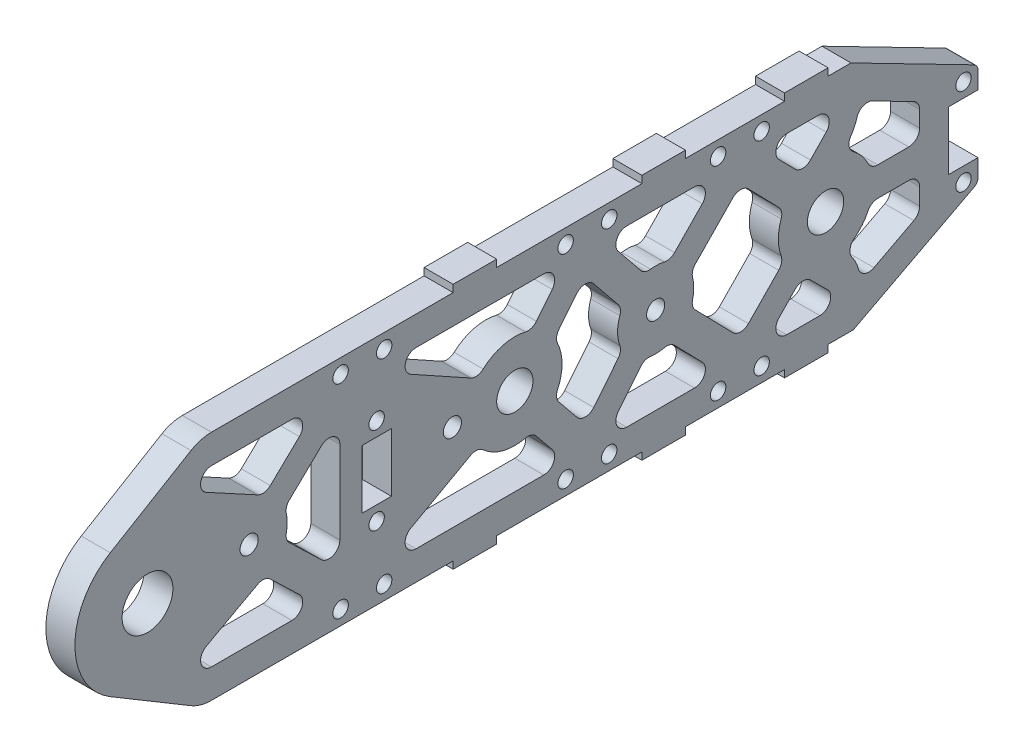
from build123d import *

# Parameters (mm, degrees)
SKETCH1_R                   = 11.1125
SKETCH1_R_2                 = 7.9375
BOSS_EXTRUDE1_DEPTH         = 12.7
BOSS_EXTRUDE2_DEPTH         = 12.7
CUT_EXTRUDE1_DEPTH          = 218.842023092
CUT_EXTRUDE2_DEPTH          = 218.842023092
FILLET1_R                   = 25.4
SKETCH5_W                   = 25.4
SKETCH5_H                   = 101.6
BOSS_EXTRUDE3_DEPTH         = 12.7
SKETCH6_W                   = 144.78
SKETCH6_H                   = 101.6
CUT_EXTRUDE3_DEPTH          = 352.269809441
CUT_EXTRUDE4_DEPTH          = 218.842023092
CUT_EXTRUDE5_DEPTH          = 218.842023092
SKETCH10_W                  = 12.827
SKETCH10_H                  = 25.654
SKETCH10_W_2                = 12.954
CUT_EXTRUDE6_DEPTH          = 218.842023092
F_1_4_CLEARANCE_HOLE1_D     = 6.7564
F_1_4_CLEARANCE_HOLE1_DEPTH = 12.7
F_1_4_CLEARANCE_HOLE1_TIP   = 2.029827343
F_3_8_16_TAPPED_HOLE1_D     = 7.9375
F_3_8_16_TAPPED_HOLE1_DEPTH = 23.876
F_3_8_16_TAPPED_HOLE1_TIP   = 2.384665582
CUT_EXTRUDE7_DEPTH          = 218.842023092
FILLET2_DEPTH               = 12.7
CUT_EXTRUDE8_DEPTH          = 218.842023092
FILLET3_R                   = 3.175
F_1_4_CLEARANCE_HOLE2_D     = 6.7564
SKETCH20_W                  = 19.05
SKETCH20_H                  = 3.175
BOSS_EXTRUDE4_DEPTH         = 12.7
CUT_EXTRUDE9_DEPTH          = 211.017070378
FILLET4_R                   = 4.7625


with BuildPart() as part:
    # Sketch1 → Boss-Extrude1 (new body)
    with BuildSketch(Plane(origin=(0, 0, 0), x_dir=(0, 0, -1), z_dir=(1, 0, 0))):
        with BuildLine():
            Line((93.345, 0), (55.245, 50.8))
            Line((55.245, 50.8), (-160.655, 50.8))
            ThreePointArc((-160.655, 50.8), (-211.455, 0), (-160.655, -50.8))
            Line((-160.655, -50.8), (55.245, -50.8))
            Line((55.245, -50.8), (93.345, 0))
        make_face()
        with Locations((-160.655, 0)):
            Circle(SKETCH1_R, mode=Mode.SUBTRACT)
        Circle(SKETCH1_R_2, mode=Mode.SUBTRACT)
    boss_extrude1 = extrude(amount=BOSS_EXTRUDE1_DEPTH)

    # Sketch2 → Boss-Extrude2 (add)
    with BuildSketch(Plane(origin=(12.7, 0, 0), x_dir=(0, 0, -1), z_dir=(1, 0, 0))):
        Polygon((-160.655, 50.8), (-211.455, 25.4), (-211.455, -25.4), (-160.655, -50.8), (-160.655, -41.746204901), (-204.042256517, 0), (-160.655, 42.284079683), align=None)
    boss_extrude2 = extrude(amount=-BOSS_EXTRUDE2_DEPTH)

    # Sketch3 → Cut-Extrude1 (cut, through all)
    with BuildSketch(Plane(origin=(12.7, 0, 0), x_dir=(0, 0, -1), z_dir=(1, 0, 0))):
        Polygon((-211.455, 25.4), (-160.655, 50.8), (-211.455, 50.8), align=None)
        Polygon((-211.455, -25.4), (-211.455, -50.8), (-160.655, -50.8), align=None)
    cut_extrude1 = extrude(amount=-CUT_EXTRUDE1_DEPTH, mode=Mode.SUBTRACT)

    # Sketch4 → Cut-Extrude2 (cut, through all)
    with BuildSketch(Plane(origin=(12.7, 0, 0), x_dir=(0, 0, -1), z_dir=(1, 0, 0))):
        Polygon((67.945, 33.866666667), (67.945, -33.866666667), (93.345, 0), align=None)
    extrude(amount=-CUT_EXTRUDE2_DEPTH, mode=Mode.SUBTRACT)

    # Fillet1
    fillet1_edges = [part.edges().sort_by_distance(p)[0] for p in [
        (6.35, -50.8, 160.655),
        (6.35, 50.8, 160.655),
        (6.35, 25.4, 211.455),
        (6.35, -25.4, 211.455),
    ]]
    fillet(fillet1_edges, radius=FILLET1_R)

    # Mirror1: Boss-Extrude1, Boss-Extrude2, Cut-Extrude1 across plane
    add(boss_extrude1.mirror(Plane(origin=(0, 33.866666667, -67.945), x_dir=(1, 0, 0), z_dir=(0, 0, 1))))
    add(boss_extrude2.mirror(Plane(origin=(0, 33.866666667, -67.945), x_dir=(1, 0, 0), z_dir=(0, 0, 1))))
    add(cut_extrude1.mirror(Plane(origin=(0, 33.866666667, -67.945), x_dir=(1, 0, 0), z_dir=(0, 0, 1))), mode=Mode.SUBTRACT)

    # Sketch5 → Boss-Extrude3 (add)
    with BuildSketch(Plane(origin=(12.7, 0, 0), x_dir=(0, 0, -1), z_dir=(1, 0, 0))):
        with Locations((67.945, 0)):
            Rectangle(SKETCH5_W, SKETCH5_H)
    extrude(amount=-BOSS_EXTRUDE3_DEPTH)

    # Sketch6 → Cut-Extrude3 (cut, through all)
    with BuildSketch(Plane(origin=(12.7, 0, 0), x_dir=(0, 0, -1), z_dir=(1, 0, 0))):
        with Locations((274.955, 0)):
            Rectangle(SKETCH6_W, SKETCH6_H)
    extrude(amount=-CUT_EXTRUDE3_DEPTH, mode=Mode.SUBTRACT)

    # Sketch7 → Cut-Extrude4 (cut, through all)
    with BuildSketch(Plane.ZY):
        Polygon((-202.565, 25.4), (-151.765, 50.8), (-202.565, 50.8), align=None)
        Polygon((-151.765, -50.8), (-202.565, -25.4), (-202.565, -50.8), align=None)
    extrude(amount=-CUT_EXTRUDE4_DEPTH, mode=Mode.SUBTRACT)

    # Sketch8 → Cut-Extrude5 (cut, through all)
    with BuildSketch(Plane.ZY):
        Polygon((-202.565, 25.4), (-151.765, 50.8), (-147.019656436, 50.8), (-202.565, 22.282951039), align=None)
        Polygon((-202.565, -22.282951039), (-148.057281256, -50.8), (-151.765, -50.8), (-202.565, -25.4), align=None)
    extrude(amount=-CUT_EXTRUDE5_DEPTH, mode=Mode.SUBTRACT)

    # Sketch10 → Cut-Extrude6 (cut, through all)
    with BuildSketch(Plane(origin=(12.7, 0, 0), x_dir=(0, 0, -1), z_dir=(1, 0, 0))):
        with Locations((196.1515, 0)):
            Rectangle(SKETCH10_W, SKETCH10_H)
        with Locations((-60.452, 0)):
            Rectangle(SKETCH10_W_2, SKETCH10_H)
    extrude(amount=-CUT_EXTRUDE6_DEPTH, mode=Mode.SUBTRACT)

    # 1/4 Clearance Hole1
    with Locations(Plane(origin=(12.7, 0, 0), x_dir=(0, 0, -1), z_dir=(1, 0, 0))):
        with Locations((-60.452, 19.05), (-60.452, -19.05), (196.215, -19.05), (196.215, 19.05)):
            Hole(F_1_4_CLEARANCE_HOLE1_D / 2, depth=F_1_4_CLEARANCE_HOLE1_DEPTH)
            with Locations((0, 0, -(F_1_4_CLEARANCE_HOLE1_DEPTH + F_1_4_CLEARANCE_HOLE1_TIP / 2))):  # 118° drill point
                Cone(0, F_1_4_CLEARANCE_HOLE1_D / 2, F_1_4_CLEARANCE_HOLE1_TIP, mode=Mode.SUBTRACT)

    # 3/8-16 Tapped Hole1
    with Locations(Plane(origin=(12.7, 0, 0), x_dir=(0, 0, -1), z_dir=(1, 0, 0))):
        with Locations((-116.205, 0), (-27.305, 0), (61.595, 0)):
            Hole(F_3_8_16_TAPPED_HOLE1_D / 2, depth=F_3_8_16_TAPPED_HOLE1_DEPTH)
            with Locations((0, 0, -(F_3_8_16_TAPPED_HOLE1_DEPTH + F_3_8_16_TAPPED_HOLE1_TIP / 2))):  # 118° drill point
                Cone(0, F_3_8_16_TAPPED_HOLE1_D / 2, F_3_8_16_TAPPED_HOLE1_TIP, mode=Mode.SUBTRACT)

    # Sketch16 → Cut-Extrude7 (cut, through all)
    with BuildSketch(Plane(origin=(12.7, 0, 0), x_dir=(0, 0, -1), z_dir=(1, 0, 0))):
        with BuildLine():
            ThreePointArc((-154.658873372, 38.1), (-151.532109655, 37.709075865), (-148.597838443, 36.560369868))
            Line((-148.597838443, 36.560369868), (-109.443989538, 15.296482684))
            Line((-109.443989538, 15.296482684), (-85.69792684, 38.1))
            Line((-85.69792684, 38.1), (-154.658873372, 38.1))
        make_face()
        with BuildLine():
            Line((-85.69792684, -38.1), (-109.443989538, -15.296482684))
            Line((-109.443989538, -15.296482684), (-148.597838443, -36.560369868))
            ThreePointArc((-148.597838443, -36.560369868), (-151.532109655, -37.709075865), (-154.658873372, -38.1))
            Line((-154.658873372, -38.1), (-85.69792684, -38.1))
        make_face()
        with BuildLine():
            Line((-76.5302, 29.296165006), (-100.690493255, 6.094859064))
            ThreePointArc((-100.690493255, 6.094859064), (-99.82735272, 3.101595738), (-99.53625, 0))
            Line((-99.53625, 0), (-76.5302, 0))
            Line((-76.5302, 0), (-76.5302, 19.05))
            Line((-76.5302, 19.05), (-76.5302, 29.296165006))
        make_face()
        with BuildLine():
            Line((-76.5302, 0), (-99.53625, 0))
            ThreePointArc((-99.53625, 0), (-99.82735272, -3.101595738), (-100.690493255, -6.094859064))
            Line((-100.690493255, -6.094859064), (-76.5302, -29.296165006))
            Line((-76.5302, -29.296165006), (-76.5302, -19.05))
            Line((-76.5302, -19.05), (-76.5302, 0))
        make_face()
        with BuildLine():
            Line((22.632370882, 38.1), (-61.654624896, 38.1))
            Line((-61.654624896, 38.1), (-52.65677679, 33.112112585))
            Line((-52.65677679, 33.112112585), (-19.22345935, 14.578611981))
            ThreePointArc((-19.22345935, 14.578611981), (-17.74098169, 13.651988145), (-16.363710029, 12.575189873))
            ThreePointArc((-16.363710029, 12.575189873), (-5.589523383, 19.866142922), (7.405754658, 19.262949001))
            Line((7.405754658, 19.262949001), (22.632370882, 38.1))
        make_face()
        with BuildLine():
            Line((-52.65677679, -33.112112585), (-61.654624896, -38.1))
            Line((-61.654624896, -38.1), (22.632370882, -38.1))
            Line((22.632370882, -38.1), (7.405754658, -19.262949001))
            ThreePointArc((7.405754658, -19.262949001), (-5.589523383, -19.866142922), (-16.363710029, -12.575189873))
            ThreePointArc((-16.363710029, -12.575189873), (-17.74098169, -13.651988145), (-19.22345935, -14.578611981))
            Line((-19.22345935, -14.578611981), (-52.65677679, -33.112112585))
        make_face()
        with BuildLine():
            Line((44.92625, 0), (20.6375, 0))
            ThreePointArc((20.6375, 0), (19.780978872, -5.883815183), (17.282512127, -11.279236713))
            Line((17.282512127, -11.279236713), (30.7975, -27.998809339))
            Line((30.7975, -27.998809339), (46.968142981, -7.993890187))
            ThreePointArc((46.968142981, -7.993890187), (45.444788709, -4.125275969), (44.92625, 0))
        make_face()
        with BuildLine():
            Line((30.7975, 27.998809339), (17.282512127, 11.279236713))
            ThreePointArc((17.282512127, 11.279236713), (19.780978872, 5.883815183), (20.6375, 0))
            Line((20.6375, 0), (44.92625, 0))
            ThreePointArc((44.92625, 0), (45.444788709, 4.125275969), (46.968142981, 7.993890187))
            Line((46.968142981, 7.993890187), (30.7975, 27.998809339))
        make_face()
        with BuildLine():
            Line((56.844900451, -15.977602475), (38.962629118, -38.1))
            Line((38.962629118, -38.1), (89.873786646, -38.1))
            Line((89.873786646, -38.1), (67.807404776, -15.467813467))
            ThreePointArc((67.807404776, -15.467813467), (62.369309597, -16.650755875), (56.844900451, -15.977602475))
        make_face()
        with BuildLine():
            Line((89.873786646, 38.1), (38.962629118, 38.1))
            Line((38.962629118, 38.1), (56.844900451, 15.977602475))
            ThreePointArc((56.844900451, 15.977602475), (62.369309597, 16.650755875), (67.807404776, 15.467813467))
            Line((67.807404776, 15.467813467), (89.873786646, 38.1))
        make_face()
        with BuildLine():
            Line((98.7425, 29.003883739), (76.900606549, 6.601941738))
            ThreePointArc((76.900606549, 6.601941738), (77.919407428, 3.370600643), (78.26375, 0))
            Line((78.26375, 0), (115.2525, 0))
            ThreePointArc((115.2525, 0), (115.857055434, 4.958582284), (117.635302013, 9.626650905))
            Line((117.635302013, 9.626650905), (98.7425, 29.003883739))
        make_face()
        with BuildLine():
            Line((115.2525, 0), (78.26375, 0))
            ThreePointArc((78.26375, 0), (77.919407428, -3.370600643), (76.900606549, -6.601941738))
            Line((76.900606549, -6.601941738), (98.7425, -29.003883739))
            Line((98.7425, -29.003883739), (117.635302013, -9.626650905))
            ThreePointArc((117.635302013, -9.626650905), (115.857055434, -4.958582284), (115.2525, 0))
        make_face()
        Polygon((125.985136032, -19.2549511), (107.611213354, -38.1), (144.935815148, -38.1), align=None)
        Polygon((143.950016039, 38.1), (107.611213354, 38.1), (125.884911842, 19.357745141), align=None)
    extrude(amount=-CUT_EXTRUDE7_DEPTH, mode=Mode.SUBTRACT)

    # Fillet2: read off the stored shape, not the designer's step
    # Fillet2 outline → Fillet2 (add)
    with BuildSketch(Plane.YZ):
        with BuildLine():
            Line((-19.2549511, -125.985136032), (-22.698700351, -122.627480512))
            ThreePointArc((-22.698700351, -122.627480512), (-21.261044394, -126.000635728), (-22.646407749, -129.395602464))
            Line((-22.646407749, -129.395602464), (-19.2549511, -125.985136032))
        make_face()
        with BuildLine():
            ThreePointArc((-38.1, -118.90618587), (-35.187839626, -114.517832019), (-30.012798102, -115.496235205))
            Line((-30.012798102, -115.496235205), (-38.1, -107.611213354))
            Line((-38.1, -107.611213354), (-38.1, -118.90618587))
        make_face()
        with BuildLine():
            Line((-38.1, -144.935815148), (-29.9605055, -136.750697176))
            ThreePointArc((-29.9605055, -136.750697176), (-35.153879633, -137.795044631), (-38.1, -133.392525888))
            Line((-38.1, -133.392525888), (-38.1, -144.935815148))
        make_face()
        with BuildLine():
            ThreePointArc((38.1, -132.744942183), (35.200421145, -137.127969797), (30.032417403, -136.173912185))
            Line((30.032417403, -136.173912185), (38.1, -143.950016039))
            Line((38.1, -143.950016039), (38.1, -132.744942183))
        make_face()
        with BuildLine():
            Line((19.357745141, -125.884911842), (22.894881804, -129.29425308))
            ThreePointArc((22.894881804, -129.29425308), (21.437483999, -125.878945546), (22.875262503, -122.455332413))
            Line((22.875262503, -122.455332413), (19.357745141, -125.884911842))
        make_face()
        with BuildLine():
            ThreePointArc((30.012798102, -115.496235205), (35.187839626, -114.517832019), (38.1, -118.90618587))
            Line((38.1, -118.90618587), (38.1, -107.611213354))
            Line((38.1, -107.611213354), (30.012798102, -115.496235205))
        make_face()
        with BuildLine():
            ThreePointArc((-6.984177792, -116.470224852), (-9.606164871, -116.642854052), (-11.920613027, -115.398688944))
            Line((-11.920613027, -115.398688944), (-9.626650905, -117.635302013))
            ThreePointArc((-9.626650905, -117.635302013), (-8.325818801, -117.006484767), (-6.984177792, -116.470224852))
        make_face()
        with BuildLine():
            Line((-29.003883739, -98.7425), (-25.506498442, -102.152450665))
            ThreePointArc((-25.506498442, -102.152450665), (-26.944296543, -98.7425), (-25.506498442, -95.332549335))
            Line((-25.506498442, -95.332549335), (-29.003883739, -98.7425))
        make_face()
        with BuildLine():
            ThreePointArc((11.920613027, -115.398688944), (9.606164871, -116.642854052), (6.984177792, -116.470224852))
            ThreePointArc((6.984177792, -116.470224852), (8.325818801, -117.006484767), (9.626650905, -117.635302013))
            Line((9.626650905, -117.635302013), (11.920613027, -115.398688944))
        make_face()
        with BuildLine():
            Line((-6.601941738, -76.900606549), (-8.68786819, -78.93438484))
            ThreePointArc((-8.68786819, -78.93438484), (-6.587057562, -77.741782256), (-4.17135156, -77.733372059))
            ThreePointArc((-4.17135156, -77.733372059), (-5.40271568, -77.363889937), (-6.601941738, -76.900606549))
        make_face()
        with BuildLine():
            ThreePointArc((25.506498442, -95.332549335), (26.944296543, -98.7425), (25.506498442, -102.152450665))
            Line((25.506498442, -102.152450665), (29.003883739, -98.7425))
            Line((29.003883739, -98.7425), (25.506498442, -95.332549335))
        make_face()
        with BuildLine():
            ThreePointArc((6.601941738, -76.900606549), (5.40271568, -77.363889937), (4.17135156, -77.733372059))
            ThreePointArc((4.17135156, -77.733372059), (6.587057562, -77.741782256), (8.68786819, -78.93438484))
            Line((8.68786819, -78.93438484), (6.601941738, -76.900606549))
        make_face()
        with BuildLine():
            ThreePointArc((-16.23878808, -65.35651409), (-16.308342898, -67.771233193), (-17.553739919, -69.841183067))
            Line((-17.553739919, -69.841183067), (-15.467813467, -67.807404776))
            ThreePointArc((-15.467813467, -67.807404776), (-15.900593124, -66.596836148), (-16.23878808, -65.35651409))
        make_face()
        with BuildLine():
            Line((-38.1, -89.873786646), (-30.012798102, -81.988764795))
            ThreePointArc((-30.012798102, -81.988764795), (-35.187839626, -82.967167981), (-38.1, -78.57881413))
            Line((-38.1, -78.57881413), (-38.1, -89.873786646))
        make_face()
        with BuildLine():
            ThreePointArc((-18.243271947, -55.013484294), (-16.811147504, -56.958921468), (-16.517794265, -59.356764268))
            ThreePointArc((-16.517794265, -59.356764268), (-16.296167257, -58.090408827), (-15.977602475, -56.844900451))
            Line((-15.977602475, -56.844900451), (-18.243271947, -55.013484294))
        make_face()
        with BuildLine():
            Line((-38.1, -38.962629118), (-38.1, -48.936163456))
            ThreePointArc((-38.1, -48.936163456), (-35.389693349, -44.638500288), (-30.343607892, -45.232379405))
            Line((-30.343607892, -45.232379405), (-38.1, -38.962629118))
        make_face()
        with BuildLine():
            ThreePointArc((16.517794265, -59.356764268), (16.811147504, -56.958921468), (18.243271947, -55.013484294))
            Line((18.243271947, -55.013484294), (15.977602475, -56.844900451))
            ThreePointArc((15.977602475, -56.844900451), (16.296167257, -58.090408827), (16.517794265, -59.356764268))
        make_face()
        with BuildLine():
            Line((38.1, -38.962629118), (30.343607892, -45.232379405))
            ThreePointArc((30.343607892, -45.232379405), (35.389693349, -44.638500288), (38.1, -48.936163456))
            Line((38.1, -48.936163456), (38.1, -38.962629118))
        make_face()
        with BuildLine():
            ThreePointArc((17.553739919, -69.841183067), (16.308342898, -67.771233193), (16.23878808, -65.35651409))
            ThreePointArc((16.23878808, -65.35651409), (15.900593124, -66.596836148), (15.467813467, -67.807404776))
            Line((15.467813467, -67.807404776), (17.553739919, -69.841183067))
        make_face()
        with BuildLine():
            Line((38.1, -89.873786646), (38.1, -78.57881413))
            ThreePointArc((38.1, -78.57881413), (35.187839626, -82.967167981), (30.012798102, -81.988764795))
            Line((30.012798102, -81.988764795), (38.1, -89.873786646))
        make_face()
        with BuildLine():
            ThreePointArc((-5.651074762, -45.913399935), (-8.057135764, -46.129216224), (-10.259559659, -45.136726825))
            Line((-10.259559659, -45.136726825), (-7.993890187, -46.968142981))
            ThreePointArc((-7.993890187, -46.968142981), (-6.842834781, -46.395564526), (-5.651074762, -45.913399935))
        make_face()
        with BuildLine():
            Line((-27.998809339, -30.7975), (-23.416808451, -34.501284051))
            ThreePointArc((-23.416808451, -34.501284051), (-25.185416343, -30.7975), (-23.416808451, -27.093715949))
            Line((-23.416808451, -27.093715949), (-27.998809339, -30.7975))
        make_face()
        with BuildLine():
            ThreePointArc((10.259559659, -45.136726825), (8.057135764, -46.129216224), (5.651074762, -45.913399935))
            ThreePointArc((5.651074762, -45.913399935), (6.842834781, -46.395564526), (7.993890187, -46.968142981))
            Line((7.993890187, -46.968142981), (10.259559659, -45.136726825))
        make_face()
        with BuildLine():
            Line((-11.279236713, -17.282512127), (-13.770868163, -19.296580883))
            ThreePointArc((-13.770868163, -19.296580883), (-11.350943468, -18.272578173), (-8.756293045, -18.687796509))
            ThreePointArc((-8.756293045, -18.687796509), (-10.042376174, -18.029339617), (-11.279236713, -17.282512127))
        make_face()
        with BuildLine():
            ThreePointArc((23.416808451, -27.093715949), (25.185416343, -30.7975), (23.416808451, -34.501284051))
            Line((23.416808451, -34.501284051), (27.998809339, -30.7975))
            Line((27.998809339, -30.7975), (23.416808451, -27.093715949))
        make_face()
        with BuildLine():
            ThreePointArc((11.279236713, -17.282512127), (10.042376174, -18.029339617), (8.756293045, -18.687796509))
            ThreePointArc((8.756293045, -18.687796509), (11.350943468, -18.272578173), (13.770868163, -19.296580883))
            Line((13.770868163, -19.296580883), (11.279236713, -17.282512127))
        make_face()
        with BuildLine():
            ThreePointArc((-20.108133954, -4.644281982), (-20.246048919, -7.268324007), (-21.754580451, -9.419823414))
            Line((-21.754580451, -9.419823414), (-19.262949001, -7.405754658))
            ThreePointArc((-19.262949001, -7.405754658), (-19.733904229, -6.039820375), (-20.108133954, -4.644281982))
        make_face()
        with BuildLine():
            Line((-38.1, -22.632370882), (-30.343607892, -16.362620595))
            ThreePointArc((-30.343607892, -16.362620595), (-35.389693349, -16.956499712), (-38.1, -12.658836544))
            Line((-38.1, -12.658836544), (-38.1, -22.632370882))
        make_face()
        with BuildLine():
            ThreePointArc((-14.656779857, 19.364469486), (-14.09106207, 16.508914754), (-15.292954273, 13.857559521))
            ThreePointArc((-15.292954273, 13.857559521), (-13.990302431, 15.171613102), (-12.575189873, 16.363710029))
            ThreePointArc((-12.575189873, 16.363710029), (-13.651988145, 17.74098169), (-14.578611981, 19.22345935))
            Line((-14.578611981, 19.22345935), (-14.656779857, 19.364469486))
        make_face()
        with BuildLine():
            Line((-38.1, 61.654624896), (-38.1, 43.240368521))
            ThreePointArc((-38.1, 43.240368521), (-34.529993325, 47.851156514), (-29.172182291, 45.549380135))
            Line((-29.172182291, 45.549380135), (-38.1, 61.654624896))
        make_face()
        with BuildLine():
            ThreePointArc((15.292954273, 13.857559521), (14.09106207, 16.508914754), (14.656779857, 19.364469486))
            Line((14.656779857, 19.364469486), (14.578611981, 19.22345935))
            ThreePointArc((14.578611981, 19.22345935), (13.651988145, 17.74098169), (12.575189873, 16.363710029))
            ThreePointArc((12.575189873, 16.363710029), (13.990302431, 15.171613102), (15.292954273, 13.857559521))
        make_face()
        with BuildLine():
            Line((38.1, 61.654624896), (29.172182291, 45.549380135))
            ThreePointArc((29.172182291, 45.549380135), (34.529993325, 47.851156514), (38.1, 43.240368521))
            Line((38.1, 43.240368521), (38.1, 61.654624896))
        make_face()
        with BuildLine():
            ThreePointArc((21.754580451, -9.419823414), (20.246048919, -7.268324007), (20.108133954, -4.644281982))
            ThreePointArc((20.108133954, -4.644281982), (19.733904229, -6.039820375), (19.262949001, -7.405754658))
            Line((19.262949001, -7.405754658), (21.754580451, -9.419823414))
        make_face()
        with BuildLine():
            Line((38.1, -22.632370882), (38.1, -12.658836544))
            ThreePointArc((38.1, -12.658836544), (35.389693349, -16.956499712), (30.343607892, -16.362620595))
            Line((30.343607892, -16.362620595), (38.1, -22.632370882))
        make_face()
        with BuildLine():
            Line((-15.296482684, 109.443989538), (-16.958333906, 112.504007261))
            ThreePointArc((-16.958333906, 112.504007261), (-16.423549923, 109.595716841), (-17.708392892, 106.932387042))
            Line((-17.708392892, 106.932387042), (-15.296482684, 109.443989538))
        make_face()
        with BuildLine():
            ThreePointArc((-38.1, 132.684356521), (-34.510036393, 137.300259971), (-29.152361299, 134.957244619))
            Line((-29.152361299, 134.957244619), (-36.560369868, 148.597838443))
            ThreePointArc((-36.560369868, 148.597838443), (-37.709075865, 151.532109656), (-38.1, 154.658873372))
            Line((-38.1, 154.658873372), (-38.1, 132.684356521))
        make_face()
        with BuildLine():
            Line((-38.1, 85.69792684), (-29.902420285, 94.23433985))
            ThreePointArc((-29.902420285, 94.23433985), (-35.115397509, 93.114872485), (-38.1, 97.53307197))
            Line((-38.1, 97.53307197), (-38.1, 85.69792684))
        make_face()
        with BuildLine():
            Line((29.296165006, 76.5302), (21.554904967, 84.591432121))
            ThreePointArc((21.554904967, 84.591432121), (22.501127455, 79.425724568), (18.119825252, 76.5302))
            Line((18.119825252, 76.5302), (29.296165006, 76.5302))
        make_face()
        with BuildLine():
            ThreePointArc((3.638188923, 99.938137736), (6.052310742, 99.850262484), (8.112751187, 98.589194924))
            Line((8.112751187, 98.589194924), (6.094859064, 100.690493255))
            ThreePointArc((6.094859064, 100.690493255), (4.881041435, 100.266911624), (3.638188923, 99.938137736))
        make_face()
        with BuildLine():
            Line((-29.296165006, 76.5302), (-18.119825252, 76.5302))
            ThreePointArc((-18.119825252, 76.5302), (-22.501127455, 79.425724568), (-21.554904967, 84.591432121))
            Line((-21.554904967, 84.591432121), (-29.296165006, 76.5302))
        make_face()
        with BuildLine():
            ThreePointArc((-8.112751187, 98.589194924), (-6.052310742, 99.850262484), (-3.638188923, 99.938137736))
            ThreePointArc((-3.638188923, 99.938137736), (-4.881041435, 100.266911624), (-6.094859064, 100.690493255))
            Line((-6.094859064, 100.690493255), (-8.112751187, 98.589194924))
        make_face()
        with BuildLine():
            Line((38.1, 85.69792684), (38.1, 97.53307197))
            ThreePointArc((38.1, 97.53307197), (35.115397509, 93.114872485), (29.902420285, 94.23433985))
            Line((29.902420285, 94.23433985), (38.1, 85.69792684))
        make_face()
        with BuildLine():
            ThreePointArc((29.152361299, 134.957244619), (34.510036393, 137.300259971), (38.1, 132.684356521))
            Line((38.1, 132.684356521), (38.1, 154.658873372))
            ThreePointArc((38.1, 154.658873372), (37.709075865, 151.532109656), (36.560369868, 148.597838443))
            Line((36.560369868, 148.597838443), (29.152361299, 134.957244619))
        make_face()
        with BuildLine():
            Line((15.296482684, 109.443989538), (17.708392892, 106.932387042))
            ThreePointArc((17.708392892, 106.932387042), (16.423549923, 109.595716841), (16.958333906, 112.504007261))
            Line((16.958333906, 112.504007261), (15.296482684, 109.443989538))
        make_face()
    extrude(amount=FILLET2_DEPTH)

    # Sketch17 → Cut-Extrude8 (cut, through all)
    with BuildSketch(Plane(origin=(12.7, 0, 0), x_dir=(0, 0, -1), z_dir=(1, 0, 0))):
        with BuildLine():
            ThreePointArc((-176.929548293, -27.261723677), (-192.405, 0), (-176.929548293, 27.261723677))
            Line((-176.929548293, 27.261723677), (-141.635358082, 48.331448022))
            ThreePointArc((-141.635358082, 48.331448022), (-137.326936025, 50.171553635), (-132.684356521, 50.8))
            Line((-132.684356521, 50.8), (-211.455, 50.8))
            Line((-211.455, 50.8), (-211.455, -50.8))
            Line((-211.455, -50.8), (-132.684356521, -50.8))
            ThreePointArc((-132.684356521, -50.8), (-137.326936025, -50.171553635), (-141.635358082, -48.331448022))
            Line((-141.635358082, -48.331448022), (-176.929548293, -27.261723677))
        make_face()
    extrude(amount=-CUT_EXTRUDE8_DEPTH, mode=Mode.SUBTRACT)

    # Fillet3
    fillet3_edges = [part.edges().sort_by_distance(p)[0] for p in [
        (6.35, 22.282951039, -202.565),
        (6.35, -22.282951039, -202.565),
    ]]
    fillet(fillet3_edges, radius=FILLET3_R)

    # 1/4 Clearance Hole2 (through all)
    with Locations(Plane(origin=(12.7, 0, 0), x_dir=(0, 0, -1), z_dir=(1, 0, 0))):
        with Locations((-76.2, 44.45), (-57.15, 44.45), (22.225, 44.45), (41.275, 44.45), (88.9, 44.45), (107.95, 44.45)):
            f_1_4_clearance_hole2 = Hole(F_1_4_CLEARANCE_HOLE2_D / 2)

    # Sketch20 → Boss-Extrude4 (add)
    with BuildSketch(Plane(origin=(12.7, 0, 0), x_dir=(0, 0, -1), z_dir=(1, 0, 0))):
        with Locations((-17.4625, 52.3875)):
            Rectangle(SKETCH20_W, SKETCH20_H)
        with Locations((65.0875, 52.3875)):
            Rectangle(SKETCH20_W, SKETCH20_H)
        with Locations((127.484828218, 52.3875)):
            Rectangle(SKETCH20_W, SKETCH20_H)
    boss_extrude4 = extrude(amount=-BOSS_EXTRUDE4_DEPTH)

    # Mirror3: 1/4 Clearance Hole2, Boss-Extrude4 across plane
    add(f_1_4_clearance_hole2.mirror(Plane.ZX), mode=Mode.SUBTRACT)
    add(boss_extrude4.mirror(Plane.ZX))

    # Sketch21 → Cut-Extrude9 (cut, through all)
    with BuildSketch(Plane(origin=(12.7, 0, 0), x_dir=(0, 0, -1), z_dir=(1, 0, 0))):
        with BuildLine():
            Line((145.31783219, 21.218863809), (143.395380387, 19.224351003))
            ThreePointArc((143.395380387, 19.224351003), (150.910146592, 14.152794869), (155.526290542, 6.35))
            Line((155.526290542, 6.35), (177.038, 6.35))
            Line((177.038, 6.35), (177.038, 21.112587589))
            Line((177.038, 21.112587589), (150.135176189, 34.924531032))
            ThreePointArc((150.135176189, 34.924531032), (149.219423318, 27.546957918), (145.31783219, 21.218863809))
        make_face()
        with BuildLine():
            ThreePointArc((155.526290542, -6.35), (151.059248486, -13.992866276), (143.801025854, -19.061009317))
            Line((143.801025854, -19.061009317), (145.705820609, -20.955186833))
            ThreePointArc((145.705820609, -20.955186833), (149.825659743, -27.430638061), (150.771137647, -35.04710802))
            Line((150.771137647, -35.04710802), (177.038, -21.30495522))
            Line((177.038, -21.30495522), (177.038, -6.35))
            Line((177.038, -6.35), (155.526290542, -6.35))
        make_face()
    extrude(amount=-CUT_EXTRUDE9_DEPTH, mode=Mode.SUBTRACT)

    # Fillet4
    fillet4_edges = [part.edges().sort_by_distance(p)[0] for p in [
        (6.35, -19.061009317, -143.801025854),
        (6.35, -6.35, -177.038),
        (6.35, -21.30495522, -177.038),
        (6.35, -35.04710802, -150.771137647),
        (6.35, -6.35, -155.526290542),
        (6.35, 21.112587589, -177.038),
        (6.35, 6.35, -177.038),
        (6.35, 6.35, -155.526290542),
        (6.35, 19.224351003, -143.395380387),
        (6.35, 34.924531032, -150.135176189),
    ]]
    fillet(fillet4_edges, radius=FILLET4_R)


solid = part.part
